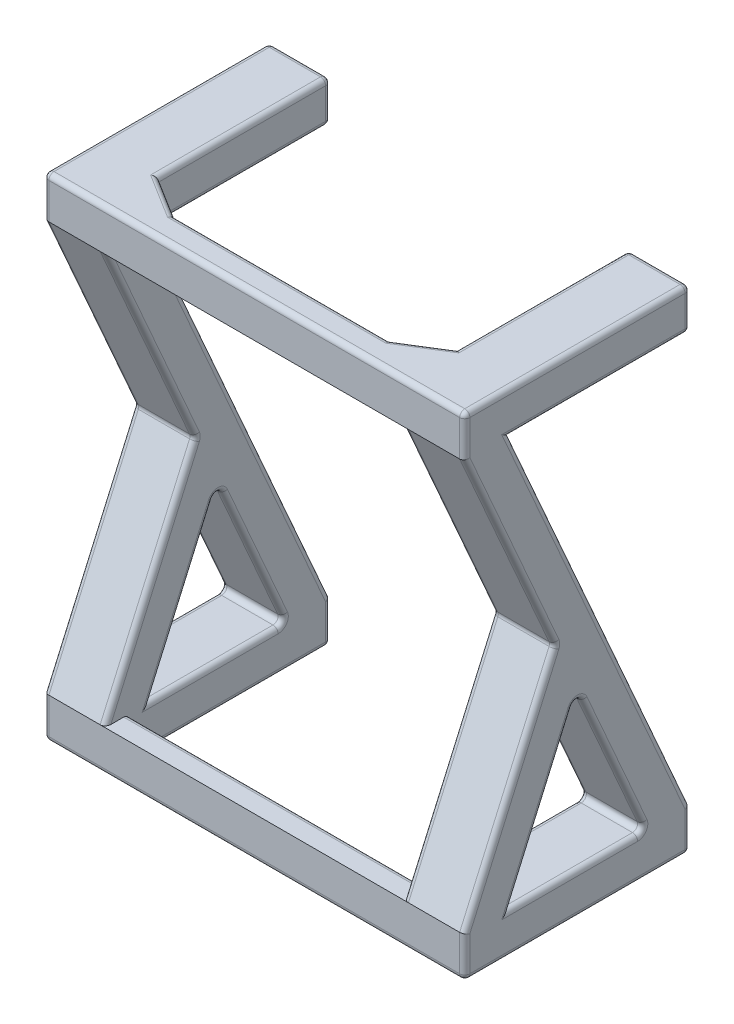
from build123d import *

# Parameters (mm, degrees)
BOSS_EXTRUDE1_DEPTH = 76.2
CUT_EXTRUDE2_DEPTH  = 107.203232697
SKETCH6_W           = 46.1645
SKETCH6_H           = 63.5
CUT_EXTRUDE3_DEPTH  = 90.941249589
CHAMFER1_SIZE       = 6.35
SKETCH3_R           = 1.905
CUT_EXTRUDE1_DEPTH  = 12.7
CUT_EXTRUDE4_DEPTH  = 6.35
FILLET1_R           = 0.79375


with BuildPart() as part:
    # Sketch2 → Boss-Extrude1 (new body)
    with BuildSketch(Plane(origin=(0, 0, 0), x_dir=(1, 0, 0), z_dir=(0, 1, 0))):
        Polygon((-32.60725, 0), (32.60725, 0), (32.60725, 34.925), (23.08225, 34.925), (23.08225, 9.525), (-23.08225, 9.525), (-23.08225, 34.925), (-32.60725, 34.925), align=None)
    extrude(amount=BOSS_EXTRUDE1_DEPTH)

    # Sketch5 → Cut-Extrude2 (cut, through all)
    with BuildSketch(Plane.ZY.offset(32.60725)):
        Polygon((-34.925, 38.1), (-34.925, 69.85), (-6.939342218, 69.85), (-34.925, 6.35), align=None)
        Polygon((-27.985657782, 6.35), (-17.4625, 30.227248996), (-6.939342218, 6.35), align=None)
        Polygon((0, 69.85), (0, 6.35), (-13.992828891, 38.1), align=None)
    extrude(amount=-CUT_EXTRUDE2_DEPTH, mode=Mode.SUBTRACT)

    # Sketch6 → Cut-Extrude3 (cut, through all)
    with BuildSketch(Plane.XY):
        with Locations((0, 38.1)):
            Rectangle(SKETCH6_W, SKETCH6_H)
    extrude(amount=-CUT_EXTRUDE3_DEPTH, mode=Mode.SUBTRACT)

    # Chamfer1
    # the kernel refuses this chamfer: 6.35 mm, written as the material it takes off along each edge
    with BuildSketch(Plane(origin=(23.08225, 6.35, -9.525), x_dir=(0, -0.9996219169112966, -0.027495876610585633), z_dir=(-1, 0, 0))) as chamfer1_piece_1:
        Polygon((CHAMFER1_SIZE * 0.999621916911, CHAMFER1_SIZE * 0.0274958766106), (-CHAMFER1_SIZE * 0.0274958766106, CHAMFER1_SIZE * 0.999621916911), (0, 0), align=None)
    extrude(amount=46.1645, mode=Mode.SUBTRACT)

    # Sketch3 → Cut-Extrude1 (cut)
    with BuildSketch(Plane(origin=(0, 0, -34.925), x_dir=(-1, 0, 0), z_dir=(0, 0, -1))):
        with Locations((-27.84475, 73.025)):
            Circle(SKETCH3_R)
        with Locations((-27.84475, 3.175)):
            Circle(SKETCH3_R)
    cut_extrude1 = extrude(amount=-CUT_EXTRUDE1_DEPTH, mode=Mode.SUBTRACT)

    # Mirror1: Cut-Extrude1 across plane
    add(cut_extrude1.mirror(Plane(origin=(0, 0, 0), x_dir=(0, 0, 1), z_dir=(1, 0, 0))), mode=Mode.SUBTRACT)

    # Sketch7 → Cut-Extrude4 (cut)
    with BuildSketch(Plane(origin=(0, 76.2, 0), x_dir=(1, 0, 0), z_dir=(0, 1, 0))):
        Polygon((23.08225, 9.525), (23.08225, 8.255), (16.66875, 4.2545), (-16.66875, 4.2545), (-23.08225, 8.255), (-23.08225, 9.525), align=None)
    extrude(amount=-CUT_EXTRUDE4_DEPTH, mode=Mode.SUBTRACT)

    # Fillet1
    fillet1_edges = [part.edges().sort_by_distance(p)[0] for p in [
        (27.84475, 0, -34.925),
        (32.60725, 0, -17.4625),
        (0, 0, 0),
        (-32.60725, 0, -17.4625),
        (32.60725, 76.2, -17.4625),
        (0, 6.35, -3.175),
        (-32.60725, 73.025, -34.925),
        (-23.08225, 73.025, -34.925),
        (23.08225, 73.025, -34.925),
        (32.60725, 73.025, -34.925),
        (32.60725, 73.025, 0),
        (-32.60725, 73.025, 0),
        (27.84475, 76.2, -34.925),
        (-19.8755, 76.2, -6.25475),
        (0, 76.2, -4.2545),
        (19.8755, 76.2, -6.25475),
        (19.8755, 69.85, -6.25475),
        (0, 69.85, -4.2545),
        (-19.8755, 69.85, -6.25475),
        (23.08225, 76.2, -21.59),
        (-32.60725, 3.175, -34.925),
        (-23.08225, 3.175, -34.925),
        (-27.84475, 6.35, -34.925),
        (-27.84475, 69.85, -34.925),
        (-23.08225, 76.2, -21.59),
        (-23.08225, 53.975, -6.996414446),
        (-23.08225, 22.225, -6.996414446),
        (-23.08225, 18.288624498, -12.200921109),
        (-23.08225, 18.288624498, -22.724078891),
        (-23.08225, 6.35, -17.4625),
        (-27.84475, 76.2, -34.925),
        (23.08225, 3.175, -34.925),
        (32.60725, 3.175, -34.925),
        (32.60725, 3.175, 0),
        (-32.60725, 3.175, 0),
        (-32.60725, 76.2, -17.4625),
        (27.84475, 6.35, -34.925),
        (27.84475, 69.85, -34.925),
        (23.08225, 69.85, -21.59),
        (-23.08225, 69.85, -21.59),
        (32.60725, 69.85, -20.932171109),
        (23.08225, 38.1, -20.932171109),
        (32.60725, 38.1, -20.932171109),
        (-23.08225, 38.1, -20.932171109),
        (-32.60725, 38.1, -20.932171109),
        (-32.60725, 69.85, -20.932171109),
        (23.08225, 6.35, -17.4625),
        (32.60725, 6.35, -17.4625),
        (27.84475, 6.35, -27.985657782),
        (23.08225, 18.288624498, -22.724078891),
        (32.60725, 18.288624498, -22.724078891),
        (-27.84475, 6.35, -27.985657782),
        (27.84475, 30.227248996, -17.4625),
        (23.08225, 18.288624498, -12.200921109),
        (-27.84475, 30.227248996, -17.4625),
        (32.60725, 18.288624498, -12.200921109),
        (-32.60725, 6.35, -17.4625),
        (-32.60725, 18.288624498, -12.200921109),
        (-32.60725, 18.288624498, -22.724078891),
        (23.08225, 22.225, -6.996414446),
        (32.60725, 22.225, -6.996414446),
        (27.84475, 38.1, -13.992828891),
        (23.08225, 53.975, -6.996414446),
        (-27.84475, 38.1, -13.992828891),
        (32.60725, 53.975, -6.996414446),
        (-32.60725, 22.225, -6.996414446),
        (-32.60725, 53.975, -6.996414446),
        (-27.84475, 0, -34.925),
        (0, 76.2, 0),
        (-23.08225, 0, -22.225),
        (0, 0, -9.525),
        (23.08225, 0, -22.225),
    ]]
    fillet(fillet1_edges, radius=FILLET1_R)


solid = part.part
